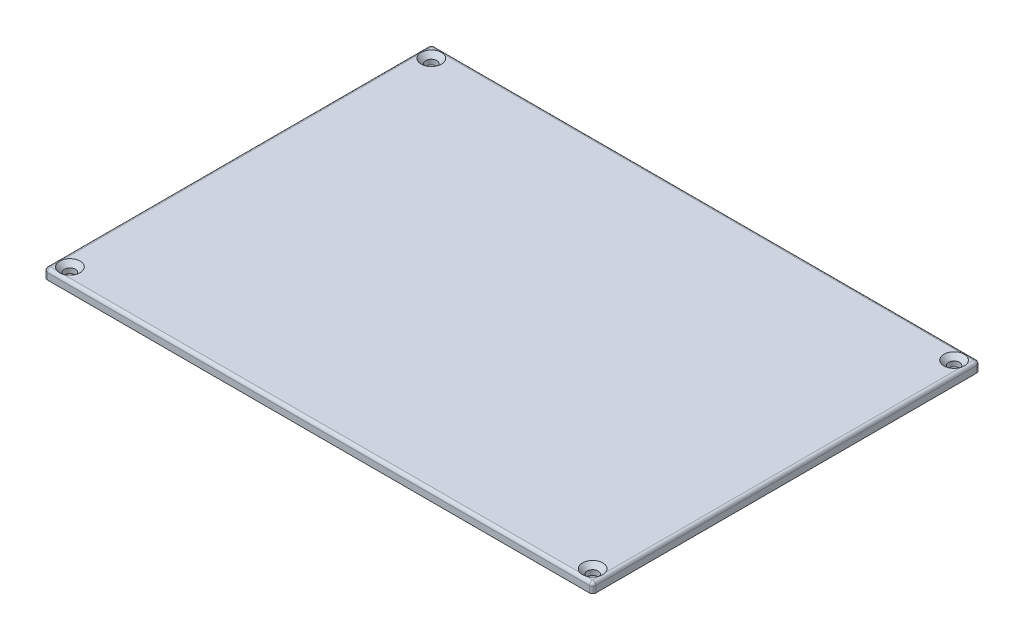
from build123d import *

# Parameters (mm, degrees)
SKETCH1_W                                      = 170
SKETCH1_H                                      = 120
BOSS_EXTRUDE1_DEPTH                            = 3
CSK_FOR_M3_FLAT_HEAD_MACHINE_SCREW1_AT_2_COUNT = 2
CSK_FOR_M3_FLAT_HEAD_MACHINE_SCREW1_AT_2_PITCH = 162
CSK_FOR_M3_FLAT_HEAD_MACHINE_SCREW1_AT_3_COUNT = 2
CSK_FOR_M3_FLAT_HEAD_MACHINE_SCREW1_AT_3_PITCH = 196.946693295
CSK_FOR_M3_FLAT_HEAD_MACHINE_SCREW1_AT_4_COUNT = 2
CSK_FOR_M3_FLAT_HEAD_MACHINE_SCREW1_AT_4_PITCH = 112
FILLET2_R                                      = 1


with BuildPart() as part:
    # Sketch1 → Boss-Extrude1 (new body)
    with BuildSketch(Plane(origin=(0, 0, 0), x_dir=(1, 0, 0), z_dir=(0, 1, 0))):
        with Locations((-70.564356436, -19.841584158)):
            Rectangle(SKETCH1_W, SKETCH1_H)
    extrude(amount=BOSS_EXTRUDE1_DEPTH)

    # Sketch4 → CSK for M3 Flat Head Machine Screw1 (revolve, cut)
    with BuildSketch(Plane(origin=(-151.564356436, 3, -36.158415842), x_dir=(0, 0, 1), z_dir=(1, 0, 0))):
        Polygon((0, 0), (0, 3), (1.7, 3), (1.7, 1.45), (3.15, 0), align=None)
    csk_for_m3_flat_head_machine_screw1 = revolve(axis=Axis((-151.564356436, 9.35, -36.158415842), (0, -1, 0)), mode=Mode.SUBTRACT)

    # CSK for M3 Flat Head Machine Screw1 at 2: CSK for M3 Flat Head Machine Screw1 ×2
    with Locations(*[(i * CSK_FOR_M3_FLAT_HEAD_MACHINE_SCREW1_AT_2_PITCH, 0, 0) for i in range(1, CSK_FOR_M3_FLAT_HEAD_MACHINE_SCREW1_AT_2_COUNT)]):
        add(csk_for_m3_flat_head_machine_screw1, mode=Mode.SUBTRACT)

    # CSK for M3 Flat Head Machine Screw1 at 3: CSK for M3 Flat Head Machine Screw1 ×2
    with Locations(*[Vector(0.8225576032241401, 0, 0.5686817997598994) * (i * CSK_FOR_M3_FLAT_HEAD_MACHINE_SCREW1_AT_3_PITCH) for i in range(1, CSK_FOR_M3_FLAT_HEAD_MACHINE_SCREW1_AT_3_COUNT)]):
        add(csk_for_m3_flat_head_machine_screw1, mode=Mode.SUBTRACT)

    # CSK for M3 Flat Head Machine Screw1 at 4: CSK for M3 Flat Head Machine Screw1 ×2
    with Locations(*[(0, 0, i * CSK_FOR_M3_FLAT_HEAD_MACHINE_SCREW1_AT_4_PITCH) for i in range(1, CSK_FOR_M3_FLAT_HEAD_MACHINE_SCREW1_AT_4_COUNT)]):
        add(csk_for_m3_flat_head_machine_screw1, mode=Mode.SUBTRACT)

    # Fillet2
    # the kernel refuses this fillet: 1 mm, written as the material it takes off along each edge
    with BuildSketch(Plane(origin=(13.435643564, 2, -39.158415842), x_dir=(1, 0, 0), z_dir=(0, 0, -1))) as fillet2_piece_1_section:
        Polygon((0, 0), (FILLET2_R, 0), (FILLET2_R, -FILLET2_R), (0, -FILLET2_R), align=None)
    fillet2_piece_1 = extrude(amount=FILLET2_R, mode=Mode.PRIVATE)
    fillet2_piece_1 = fillet2_piece_1 - Plane(origin=(13.435643564, 2, -39.158415842), x_dir=(-0.7071067811865475, -0.7071067811865475, 0), z_dir=(0, 0, -1)) * Sphere(FILLET2_R, mode=Mode.PRIVATE)
    add(fillet2_piece_1, mode=Mode.SUBTRACT)
    with BuildSketch(Plane(origin=(13.435643564, 2, 78.841584158), x_dir=(0, 1, 0), z_dir=(1, 0, 0))) as fillet2_piece_2_section:
        Polygon((0, 0), (FILLET2_R, 0), (FILLET2_R, FILLET2_R), (0, FILLET2_R), align=None)
    fillet2_piece_2 = extrude(amount=FILLET2_R, mode=Mode.PRIVATE)
    fillet2_piece_2 = fillet2_piece_2 - Plane(origin=(13.435643564, 2, 78.841584158), x_dir=(0, -0.7071067811865475, -0.7071067811865475), z_dir=(1, 0, 0)) * Sphere(FILLET2_R, mode=Mode.PRIVATE)
    add(fillet2_piece_2, mode=Mode.SUBTRACT)
    with BuildSketch(Plane(origin=(-154.564356436, 2, -39.158415842), x_dir=(-1, 0, 0), z_dir=(0, 0, -1))) as fillet2_piece_3_section:
        Polygon((0, 0), (FILLET2_R, 0), (FILLET2_R, FILLET2_R), (0, FILLET2_R), align=None)
    fillet2_piece_3 = extrude(amount=FILLET2_R, mode=Mode.PRIVATE)
    fillet2_piece_3 = fillet2_piece_3 - Plane(origin=(-154.564356436, 2, -39.158415842), x_dir=(0.7071067811865475, -0.7071067811865475, 0), z_dir=(0, 0, -1)) * Sphere(FILLET2_R, mode=Mode.PRIVATE)
    add(fillet2_piece_3, mode=Mode.SUBTRACT)
    with BuildSketch(Plane(origin=(-154.564356436, 2, 78.841584158), x_dir=(0, 1, 0), z_dir=(-1, 0, 0))) as fillet2_piece_4_section:
        Polygon((0, 0), (FILLET2_R, 0), (FILLET2_R, -FILLET2_R), (0, -FILLET2_R), align=None)
    fillet2_piece_4 = extrude(amount=FILLET2_R, mode=Mode.PRIVATE)
    fillet2_piece_4 = fillet2_piece_4 - Plane(origin=(-154.564356436, 2, 78.841584158), x_dir=(0, -0.7071067811865475, -0.7071067811865475), z_dir=(-1, 0, 0)) * Sphere(FILLET2_R, mode=Mode.PRIVATE)
    add(fillet2_piece_4, mode=Mode.SUBTRACT)
    with BuildSketch(Plane(origin=(14.435643564, 3, -39.158415842), x_dir=(0, -1, 0), z_dir=(0, 0, 1)), Plane(origin=(-155.564356436, 3, 78.841584158), x_dir=(0, -1, 0), z_dir=(0, 0, -1))) as fillet2_piece_5:
        with BuildLine():
            CenterArc((FILLET2_R, -FILLET2_R), FILLET2_R, 90, 90)
            Line((0, -FILLET2_R), (0, 0))
            Line((0, 0), (FILLET2_R, 0))
        make_face()
    extrude(amount=118, mode=Mode.SUBTRACT)
    with BuildSketch(Plane(origin=(-154.564356436, 3, -40.158415842), x_dir=(0, -1, 0), z_dir=(1, 0, 0))) as fillet2_piece_6:
        with BuildLine():
            CenterArc((FILLET2_R, -FILLET2_R), FILLET2_R, 90, 90)
            Line((0, -FILLET2_R), (0, 0))
            Line((0, 0), (FILLET2_R, 0))
        make_face()
    extrude(amount=168, mode=Mode.SUBTRACT)
    with BuildSketch(Plane(origin=(-155.564356436, -2.5, -40.158415842), x_dir=(1, 0, 0), z_dir=(0, 1, 0)), Plane(origin=(-155.564356436, -2.5, 79.841584158), x_dir=(0, 0, -1), z_dir=(0, 1, 0))) as fillet2_piece_7:
        with BuildLine():
            CenterArc((FILLET2_R, -FILLET2_R), FILLET2_R, 90, 90)
            Line((0, -FILLET2_R), (0, 0))
            Line((0, 0), (FILLET2_R, 0))
        make_face()
    extrude(amount=4.5, mode=Mode.SUBTRACT)
    with BuildSketch(Plane(origin=(14.435643564, -2.5, -40.158415842), x_dir=(-1, 0, 0), z_dir=(0, 1, 0)), Plane(origin=(14.435643564, -2.5, 79.841584158), x_dir=(0, 0, -1), z_dir=(0, 1, 0))) as fillet2_piece_8:
        with BuildLine():
            CenterArc((FILLET2_R, FILLET2_R), FILLET2_R, 180, 90)
            Line((0, FILLET2_R), (0, 0))
            Line((0, 0), (FILLET2_R, 0))
        make_face()
    extrude(amount=4.5, mode=Mode.SUBTRACT)
    with BuildSketch(Plane(origin=(13.435643564, 3, 79.841584158), x_dir=(0, 0, -1), z_dir=(-1, 0, 0))) as fillet2_piece_9:
        with BuildLine():
            CenterArc((FILLET2_R, FILLET2_R), FILLET2_R, 180, 90)
            Line((0, FILLET2_R), (0, 0))
            Line((0, 0), (FILLET2_R, 0))
        make_face()
    extrude(amount=168, mode=Mode.SUBTRACT)


solid = part.part
